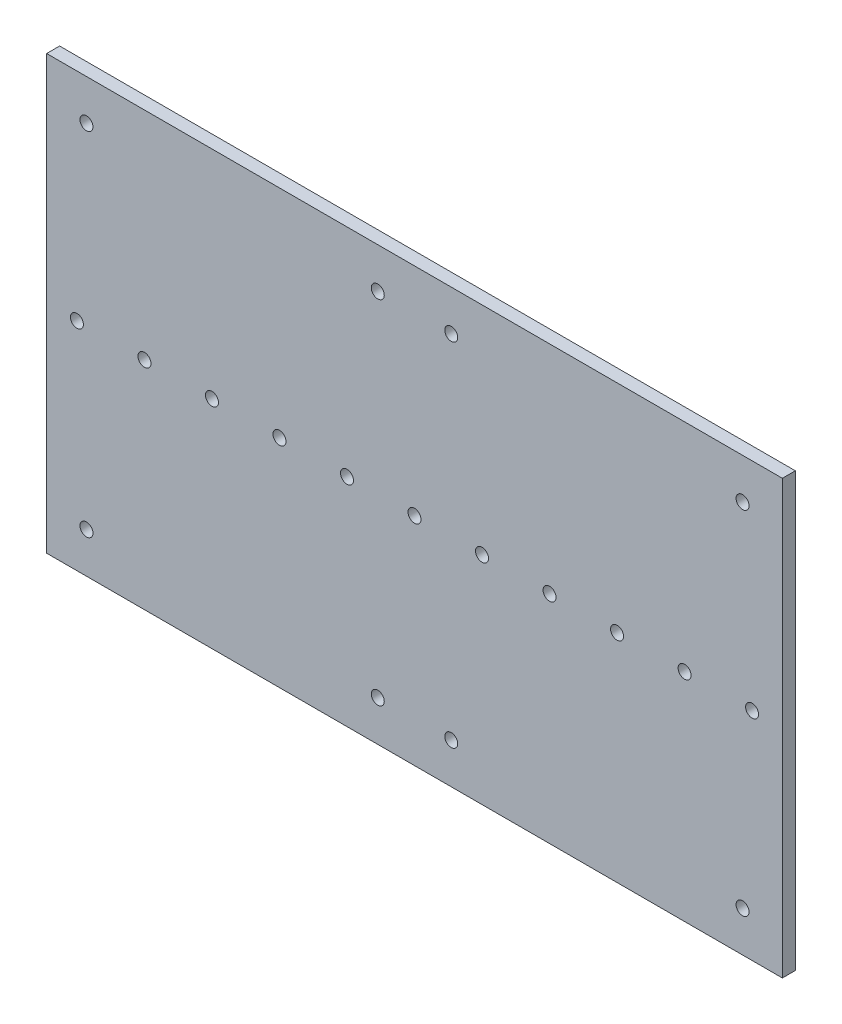
from build123d import *

# Parameters (mm, degrees)
SKETCH1_W           = 170
SKETCH1_H           = 100
BOSS_EXTRUDE1_DEPTH = 3
SKETCH2_R           = 1.5
CUT_EXTRUDE1_DEPTH  = 4


with BuildPart() as part:
    # Sketch1 → Boss-Extrude1 (new body)
    with BuildSketch(Plane.XY):
        Rectangle(SKETCH1_W, SKETCH1_H)
    extrude(amount=BOSS_EXTRUDE1_DEPTH)

    # Sketch2 → Cut-Extrude1 (cut)
    with BuildSketch(Plane.XY.offset(3)):
        with Locations((-75.8, 40.64)):
            Circle(SKETCH2_R)
        with Locations((-75.8, -40.64)):
            Circle(SKETCH2_R)
        with Locations((75.8, 40.64)):
            Circle(SKETCH2_R)
        with Locations((75.8, -40.64)):
            Circle(SKETCH2_R)
        with Locations((-8.49, 40.64)):
            Circle(SKETCH2_R)
        with Locations((-8.49, -40.64)):
            Circle(SKETCH2_R)
        with Locations((8.49, 40.64)):
            Circle(SKETCH2_R)
        with Locations((8.49, -40.64)):
            Circle(SKETCH2_R)
        Circle(SKETCH2_R)
        with Locations((15.6, 0)):
            Circle(SKETCH2_R)
        with Locations((31.2, 0)):
            Circle(SKETCH2_R)
        with Locations((46.8, 0)):
            Circle(SKETCH2_R)
        with Locations((62.4, 0)):
            Circle(SKETCH2_R)
        with Locations((78, 0)):
            Circle(SKETCH2_R)
        with Locations((-15.6, 0)):
            Circle(SKETCH2_R)
        with Locations((-31.2, 0)):
            Circle(SKETCH2_R)
        with Locations((-46.8, 0)):
            Circle(SKETCH2_R)
        with Locations((-62.4, 0)):
            Circle(SKETCH2_R)
        with Locations((-78, 0)):
            Circle(SKETCH2_R)
    extrude(amount=-CUT_EXTRUDE1_DEPTH, mode=Mode.SUBTRACT)


solid = part.part
